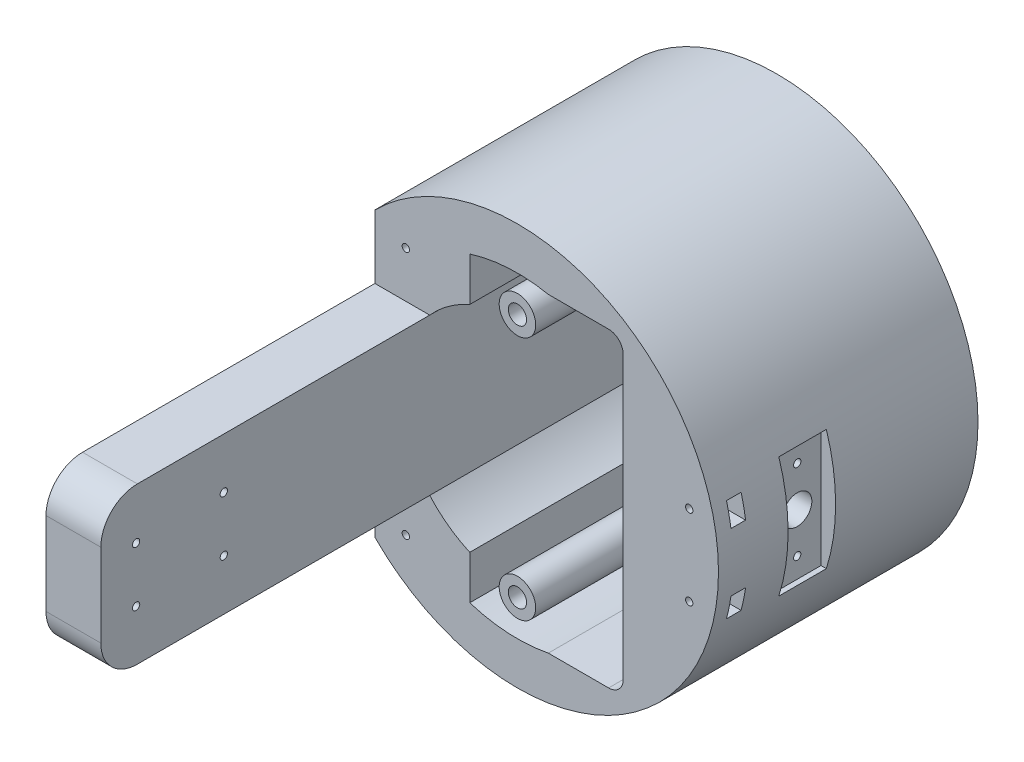
from build123d import *

# Parameters (mm, degrees)
SKETCH1_R            = 55
BOSS_EXTRUDE1_DEPTH  = 40
SKETCH2_W            = 20.494473429
SKETCH2_H            = 85
CUT_EXTRUDE1_DEPTH   = 88.464278423
BOSS_EXTRUDE2_DEPTH  = 40
SKETCH4_W            = 40
SKETCH4_H            = 85
CUT_EXTRUDE2_DEPTH   = 0.00527065
FILLET1_R            = 4
SKETCH5_R            = 4
CUT_EXTRUDE3_DEPTH   = 26.05598176
SKETCH6_W            = 13
SKETCH6_H            = 33
CUT_EXTRUDE4_DEPTH   = 4
SKETCH7_R            = 1
CUT_EXTRUDE5_DEPTH   = 22.05598176
SKETCH8_W            = 4
SKETCH8_H            = 6
CUT_EXTRUDE6_DEPTH   = 88.464278423
BOSS_EXTRUDE3_DEPTH  = 40
CUT_EXTRUDE7_DEPTH   = 88.464278423
SKETCH11_W           = 15
SKETCH11_H           = 42.720018726
BOSS_EXTRUDE4_DEPTH  = 93.97947282
SKETCH12_R           = 1
CUT_EXTRUDE8_DEPTH   = 165.974237798
SKETCH13_R           = 2.45
CUT_EXTRUDE9_DEPTH   = 4
CUT_EXTRUDE10_DEPTH  = 122.992382186
BOSS_EXTRUDE5_START  = 22
SKETCH15_W           = 4
SKETCH15_H           = 6
BOSS_EXTRUDE5_DEPTH  = 22
BOSS_EXTRUDE6_START  = 5
SKETCH16_W           = 4
SKETCH16_H           = 6
BOSS_EXTRUDE6_DEPTH  = 5
SKETCH17_R           = 5
BOSS_EXTRUDE7_DEPTH  = 62
BOSS_EXTRUDE8_DEPTH  = 4
SKETCH19_R           = 5
BOSS_EXTRUDE9_DEPTH  = 4
SKETCH20_R           = 2.5
CUT_EXTRUDE11_DEPTH  = 7
CUT_EXTRUDE12_START  = -1
SKETCH21_R           = 5
CUT_EXTRUDE12_DEPTH  = 1
SKETCH22_R           = 1
CUT_EXTRUDE13_DEPTH  = 10
CUT_EXTRUDE14_REACH  = 174.66
SKETCH23_W           = 4
SKETCH23_H           = 6
SKETCH24_W           = 4
SKETCH24_H           = 7
SKETCH24_H_2         = 6.292378966
CUT_EXTRUDE15_DEPTH  = 13
CUT_EXTRUDE16_REACH  = 180.786
SKETCH25_R           = 3.5
SKETCH27_R           = 7.5
SKETCH27_R_2         = 3.5
BOSS_EXTRUDE11_DEPTH = 9
FILLET3_R            = 10
FILLET4_R            = 8
FILLET5_R            = 4


with BuildPart() as part:
    # Sketch1 → Boss-Extrude1 (new body)
    with BuildSketch(Plane.XY):
        Circle(SKETCH1_R)
        with BuildLine():
            Line((1.5, -40), (-1.5, -40))
            ThreePointArc((-1.5, -40), (-8.571067812, -37.071067812), (-11.5, -30))
            ThreePointArc((-11.5, -30), (-32.128647653, 0), (-11.5, 30))
            ThreePointArc((-11.5, 30), (-8.571067812, 37.071067812), (-1.5, 40))
            Line((-1.5, 40), (1.5, 40))
            ThreePointArc((1.5, 40), (8.571067812, 37.071067812), (11.5, 30))
            ThreePointArc((11.5, 30), (32.128647653, 0), (11.5, -30))
            ThreePointArc((11.5, -30), (8.571067812, -37.071067812), (1.5, -40))
        make_face(mode=Mode.SUBTRACT)
    extrude(amount=BOSS_EXTRUDE1_DEPTH)

    # Sketch2 → Cut-Extrude1 (cut, through all)
    with BuildSketch(Plane(origin=(0, 0, 0), x_dir=(-1, 0, 0), z_dir=(0, 0, -1))):
        with Locations((-18.691510876, 0)):
            Rectangle(SKETCH2_W, SKETCH2_H)
    extrude(amount=-CUT_EXTRUDE1_DEPTH, mode=Mode.SUBTRACT)

    # Sketch3 → Boss-Extrude2 (add, through all)
    with BuildSketch(Plane(origin=(0, 0, 0), x_dir=(-1, 0, 0), z_dir=(0, 0, -1))):
        with BuildLine():
            Line((-28.93874759, 13.957037218), (-28.93874759, -13.957037218))
            ThreePointArc((-28.93874759, -13.957037218), (-32.128647653, 0), (-28.93874759, 13.957037218))
        make_face()
    extrude(amount=-BOSS_EXTRUDE2_DEPTH)

    # Sketch4 → Cut-Extrude2 (cut)
    with BuildSketch(Plane.ZY.offset(-28.93874759)):
        with Locations((20, 0)):
            Rectangle(SKETCH4_W, SKETCH4_H)
    extrude(amount=-CUT_EXTRUDE2_DEPTH, mode=Mode.SUBTRACT)

    # Fillet1
    fillet1_edges = [part.edges().sort_by_distance(p)[0] for p in [
        (28.94401824, 42.5, 20),
        (28.94401824, -42.5, 20),
    ]]
    fillet(fillet1_edges, radius=FILLET1_R)

    # Sketch5 → Cut-Extrude3 (cut)
    with BuildSketch(Plane(origin=(55, 0, 0), x_dir=(0, 0, -1), z_dir=(1, 0, 0))):
        with Locations(Location((-18.45620411, 0, 0), (0, 0, 180))):
            Circle(SKETCH5_R)
    extrude(amount=-CUT_EXTRUDE3_DEPTH, mode=Mode.SUBTRACT)

    # Sketch6 → Cut-Extrude4 (cut)
    with BuildSketch(Plane(origin=(55, 0, 0), x_dir=(0, 0, -1), z_dir=(1, 0, 0))):
        with Locations((-18.45620411, 0)):
            Rectangle(SKETCH6_W, SKETCH6_H)
    extrude(amount=-CUT_EXTRUDE4_DEPTH, mode=Mode.SUBTRACT)

    # Sketch7 → Cut-Extrude5 (cut)
    with BuildSketch(Plane(origin=(51, 0, 0), x_dir=(0, 0, -1), z_dir=(1, 0, 0))):
        with Locations((-18.45620411, 11)):
            Circle(SKETCH7_R)
        with Locations((-18.45620411, -11)):
            Circle(SKETCH7_R)
    extrude(amount=-CUT_EXTRUDE5_DEPTH, mode=Mode.SUBTRACT)

    # Sketch8 → Cut-Extrude6 (cut, through all)
    with BuildSketch(Plane(origin=(0, 0, 0), x_dir=(-1, 0, 0), z_dir=(0, 0, -1))):
        with Locations((-45, 11)):
            Rectangle(SKETCH8_W, SKETCH8_H)
        with Locations((-45, -11)):
            Rectangle(SKETCH8_W, SKETCH8_H)
    extrude(amount=-CUT_EXTRUDE6_DEPTH, mode=Mode.SUBTRACT)

    # Sketch9 → Boss-Extrude3 (add, through all)
    with BuildSketch(Plane.XY.offset(40)):
        with BuildLine():
            Line((-24, 21.360009363), (-24, -21.360009363))
            ThreePointArc((-24, -21.360009363), (-32.128647653, 0), (-24, 21.360009363))
        make_face()
    extrude(amount=-BOSS_EXTRUDE3_DEPTH)

    # Sketch10 → Cut-Extrude7 (cut, through all)
    with BuildSketch(Plane.XY.offset(40)):
        with BuildLine():
            Line((-39, 38.781438859), (-39, -38.781438859))
            ThreePointArc((-39, -38.781438859), (-55, 0), (-39, 38.781438859))
        make_face()
    extrude(amount=-CUT_EXTRUDE7_DEPTH, mode=Mode.SUBTRACT)

    # Sketch11 → Boss-Extrude4 (add)
    with BuildSketch(Plane.XY.offset(40)):
        with Locations((-31.5, 0)):
            Rectangle(SKETCH11_W, SKETCH11_H)
    extrude(amount=BOSS_EXTRUDE4_DEPTH)

    # Sketch12 → Cut-Extrude8 (cut, through all)
    with BuildSketch(Plane(origin=(-24, 0, 0), x_dir=(0, 0, -1), z_dir=(1, 0, 0))):
        with Locations((-124.32947282, -7.474399757)):
            Circle(SKETCH12_R)
        with Locations((-124.32947282, 7.525600243)):
            Circle(SKETCH12_R)
        with Locations((-100.32947282, -7.474399757)):
            Circle(SKETCH12_R)
        with Locations((-100.32947282, 7.525600243)):
            Circle(SKETCH12_R)
    extrude(amount=-CUT_EXTRUDE8_DEPTH, mode=Mode.SUBTRACT)

    # Sketch13 → Cut-Extrude9 (cut)
    with BuildSketch(Plane.ZY.offset(39)):
        with Locations((100.32947282, 7.525600243)):
            Circle(SKETCH13_R)
        with Locations((124.32947282, 7.525600243)):
            Circle(SKETCH13_R)
        with Locations((124.32947282, -7.474399757)):
            Circle(SKETCH13_R)
        with Locations((100.32947282, -7.474399757)):
            Circle(SKETCH13_R)
    extrude(amount=-CUT_EXTRUDE9_DEPTH, mode=Mode.SUBTRACT)

    # Sketch14 → Cut-Extrude10 (cut, through all)
    with BuildSketch(Plane.XY.offset(40)):
        with BuildLine():
            Line((-24, -21.360009363), (-24, 21.360009363))
            ThreePointArc((-24, 21.360009363), (-18.950756064, 25.944534003), (-13.047599403, 29.360009363))
            Line((-13.047599403, 29.360009363), (-13.047599403, 41.319679523))
            ThreePointArc((-13.047599403, 41.319679523), (9.151901203, 42.353258086), (28.94401824, 32.245923374))
            Line((28.94401824, 32.245923374), (28.94401824, -32.245923374))
            ThreePointArc((28.94401824, -32.245923374), (9.151901203, -42.353258086), (-13.047599403, -41.319679523))
            Line((-13.047599403, -41.319679523), (-13.047599403, -29.360009363))
            ThreePointArc((-13.047599403, -29.360009363), (-18.950756064, -25.944534003), (-24, -21.360009363))
        make_face()
    extrude(amount=-CUT_EXTRUDE10_DEPTH, mode=Mode.SUBTRACT)

    # Sketch15 → Boss-Extrude5 (add)
    with BuildSketch(Plane(origin=(0, 0, 0), x_dir=(-1, 0, 0), z_dir=(0, 0, -1)).offset(BOSS_EXTRUDE5_START)):
        with BuildLine():
            Line((39, 38.781438859), (39, -38.781438859))
            ThreePointArc((39, -38.781438859), (-55, 0), (39, 38.781438859))
        make_face()
        with BuildLine():
            Line((-24.94401824, -42.5), (-8.444274161, -42.5))
            ThreePointArc((-8.444274161, -42.5), (2.376118669, -43.265573221), (13.047599403, -41.319679523))
            Line((13.047599403, -41.319679523), (13.047599403, -29.360009363))
            ThreePointArc((13.047599403, -29.360009363), (18.950756064, -25.944534003), (24, -21.360009363))
            Line((24, -21.360009363), (24, 21.360009363))
            ThreePointArc((24, 21.360009363), (18.950756064, 25.944534003), (13.047599403, 29.360009363))
            Line((13.047599403, 29.360009363), (13.047599403, 41.319679523))
            ThreePointArc((13.047599403, 41.319679523), (2.376118669, 43.265573221), (-8.444274161, 42.5))
            Line((-8.444274161, 42.5), (-24.94401824, 42.5))
            ThreePointArc((-24.94401824, 42.5), (-27.772445365, 41.328427125), (-28.94401824, 38.5))
            Line((-28.94401824, 38.5), (-28.94401824, -38.5))
            ThreePointArc((-28.94401824, -38.5), (-27.772445365, -41.328427125), (-24.94401824, -42.5))
        make_face(mode=Mode.SUBTRACT)
        with Locations((-45, -11)):
            Rectangle(SKETCH15_W, SKETCH15_H, mode=Mode.SUBTRACT)
        with Locations((-45, 11)):
            Rectangle(SKETCH15_W, SKETCH15_H, mode=Mode.SUBTRACT)
    extrude(amount=-BOSS_EXTRUDE5_DEPTH)

    # Sketch16 → Boss-Extrude6 (add)
    with BuildSketch(Plane(origin=(0, 0, -22), x_dir=(-1, 0, 0), z_dir=(0, 0, -1)).offset(BOSS_EXTRUDE6_START)):
        with BuildLine():
            Line((39, -38.781438859), (39, 38.781438859))
            ThreePointArc((39, 38.781438859), (-55, 0), (39, -38.781438859))
        make_face()
        with Locations((-45, -11)):
            Rectangle(SKETCH16_W, SKETCH16_H, mode=Mode.SUBTRACT)
        with Locations((-45, 11)):
            Rectangle(SKETCH16_W, SKETCH16_H, mode=Mode.SUBTRACT)
    extrude(amount=-BOSS_EXTRUDE6_DEPTH)

    # Sketch17 → Boss-Extrude7 (add)
    with BuildSketch(Plane.XY.offset(-22)):
        with Locations(Location((0, 33.5, 0), (0, 0, 180))):
            Circle(SKETCH17_R)
        with Locations(Location((0, -33.5, 0), (0, 0, 180))):
            Circle(SKETCH17_R)
    extrude(amount=BOSS_EXTRUDE7_DEPTH)

    # Sketch18 → Boss-Extrude8 (add)
    with BuildSketch(Plane.XY.offset(40)):
        with BuildLine():
            Line((-24, -21.360009363), (-39, -21.360009363))
            Line((-39, -21.360009363), (-39, -38.781438859))
            ThreePointArc((-39, -38.781438859), (55, 0), (-39, 38.781438859))
            Line((-39, 38.781438859), (-39, 21.360009363))
            Line((-39, 21.360009363), (-24, 21.360009363))
            ThreePointArc((-24, 21.360009363), (-18.950756064, 25.944534003), (-13.047599403, 29.360009363))
            Line((-13.047599403, 29.360009363), (-13.047599403, 41.319679523))
            ThreePointArc((-13.047599403, 41.319679523), (-2.376118669, 43.265573221), (8.444274161, 42.5))
            Line((8.444274161, 42.5), (24.94401824, 42.5))
            ThreePointArc((24.94401824, 42.5), (27.772445365, 41.328427125), (28.94401824, 38.5))
            Line((28.94401824, 38.5), (28.94401824, -38.5))
            ThreePointArc((28.94401824, -38.5), (27.772445365, -41.328427125), (24.94401824, -42.5))
            Line((24.94401824, -42.5), (8.444274161, -42.5))
            ThreePointArc((8.444274161, -42.5), (-2.376118669, -43.265573221), (-13.047599403, -41.319679523))
            Line((-13.047599403, -41.319679523), (-13.047599403, -29.360009363))
            ThreePointArc((-13.047599403, -29.360009363), (-18.950756064, -25.944534003), (-24, -21.360009363))
        make_face()
    extrude(amount=BOSS_EXTRUDE8_DEPTH)

    # Sketch19 → Boss-Extrude9 (add)
    with BuildSketch(Plane.XY.offset(40)):
        with Locations(Location((0, 33.5, 0), (0, 0, 180))):
            Circle(SKETCH19_R)
        with Locations(Location((0, -33.5, 0), (0, 0, 180))):
            Circle(SKETCH19_R)
    extrude(amount=BOSS_EXTRUDE9_DEPTH)

    # Sketch20 → Cut-Extrude11 (cut)
    with BuildSketch(Plane.XY.offset(44)):
        with Locations((0, 33.5)):
            Circle(SKETCH20_R)
        with Locations((0, -33.5)):
            Circle(SKETCH20_R)
    extrude(amount=-CUT_EXTRUDE11_DEPTH, mode=Mode.SUBTRACT)

    # Sketch21 → Cut-Extrude12 (cut)
    with BuildSketch(Plane.XY.offset(-22).offset(CUT_EXTRUDE12_START)):
        with BuildLine():
            Line((8.444274161, -42.5), (24.94401824, -42.5))
            ThreePointArc((24.94401824, -42.5), (27.772445365, -41.328427125), (28.94401824, -38.5))
            Line((28.94401824, -38.5), (28.94401824, 38.5))
            ThreePointArc((28.94401824, 38.5), (27.772445365, 41.328427125), (24.94401824, 42.5))
            Line((24.94401824, 42.5), (8.444274161, 42.5))
            ThreePointArc((8.444274161, 42.5), (-2.376118669, 43.265573221), (-13.047599403, 41.319679523))
            Line((-13.047599403, 41.319679523), (-13.047599403, 29.360009363))
            ThreePointArc((-13.047599403, 29.360009363), (-18.950756064, 25.944534003), (-24, 21.360009363))
            Line((-24, 21.360009363), (-24, -21.360009363))
            ThreePointArc((-24, -21.360009363), (-18.950756064, -25.944534003), (-13.047599403, -29.360009363))
            Line((-13.047599403, -29.360009363), (-13.047599403, -41.319679523))
            ThreePointArc((-13.047599403, -41.319679523), (-2.376118669, -43.265573221), (8.444274161, -42.5))
        make_face()
        with Locations((0, 33.5)):
            Circle(SKETCH21_R, mode=Mode.SUBTRACT)
        with Locations((0, -33.5)):
            Circle(SKETCH21_R, mode=Mode.SUBTRACT)
    extrude(amount=CUT_EXTRUDE12_DEPTH, mode=Mode.SUBTRACT)

    # Sketch22 → Cut-Extrude13 (cut)
    with BuildSketch(Plane.XY.offset(44)):
        with Locations((-30.537878891, -34)):
            Circle(SKETCH22_R)
        with Locations((-30.537878891, 34)):
            Circle(SKETCH22_R)
        with Locations((47, 11)):
            Circle(SKETCH22_R)
        with Locations((47, -11)):
            Circle(SKETCH22_R)
    extrude(amount=-CUT_EXTRUDE13_DEPTH, mode=Mode.SUBTRACT)

    # Sketch23 → Cut-Extrude14 (cut, up to next)
    with BuildSketch(Plane(origin=(55, 0, 0), x_dir=(0, 0, -1), z_dir=(1, 0, 0)), mode=Mode.PRIVATE) as cut_extrude14_sk1:
        with Locations((-38, -11)):
            Rectangle(SKETCH23_W, SKETCH23_H)
    cut_extrude14_tool1 = extrude(cut_extrude14_sk1.sketch, amount=-CUT_EXTRUDE14_REACH, mode=Mode.PRIVATE) & part.part
    # Sketch23 → Cut-Extrude14 (cut, up to next)
    with BuildSketch(Plane(origin=(55, 0, 0), x_dir=(0, 0, -1), z_dir=(1, 0, 0)), mode=Mode.PRIVATE) as cut_extrude14_sk2:
        with Locations((-38, 11)):
            Rectangle(SKETCH23_W, SKETCH23_H)
    cut_extrude14_tool2 = extrude(cut_extrude14_sk2.sketch, amount=-CUT_EXTRUDE14_REACH, mode=Mode.PRIVATE) & part.part
    add(cut_extrude14_tool1.solids().sort_by_distance((55, -11, 38))[0], mode=Mode.SUBTRACT)
    add(cut_extrude14_tool2.solids().sort_by_distance((55, 11, 38))[0], mode=Mode.SUBTRACT)

    # Sketch24 → Cut-Extrude15 (cut)
    with BuildSketch(Plane.ZY.offset(39)):
        with Locations((38.5, 34)):
            Rectangle(SKETCH24_W, SKETCH24_H)
        with Locations((38.5, -34)):
            Rectangle(SKETCH24_W, SKETCH24_H_2)
    extrude(amount=-CUT_EXTRUDE15_DEPTH, mode=Mode.SUBTRACT)

    # Sketch25 → Cut-Extrude16 (cut, up to next)
    with BuildSketch(Plane(origin=(0, 0, -27), x_dir=(-1, 0, 0), z_dir=(0, 0, -1)), mode=Mode.PRIVATE) as cut_extrude16_sk1:
        with Locations(Location((0, 0, 0), (0, 0, 90))):
            Circle(SKETCH25_R)
    cut_extrude16_tool1 = extrude(cut_extrude16_sk1.sketch, amount=-CUT_EXTRUDE16_REACH, mode=Mode.PRIVATE) & part.part
    add(cut_extrude16_tool1.solids().sort_by_distance((0, 0, -27))[0], mode=Mode.SUBTRACT)

    # Sketch27 → Boss-Extrude11 (add)
    with BuildSketch(Plane.XY.offset(-23)):
        Circle(SKETCH27_R)
        with Locations(Location((0, 0, 0), (0, 0, 90))):
            Circle(SKETCH27_R_2, mode=Mode.SUBTRACT)
    extrude(amount=BOSS_EXTRUDE11_DEPTH)

    # Fillet3
    fillet3_edges = [part.edges().sort_by_distance(p)[0] for p in [
        (-31.5, -21.360009363, 133.97947282),
        (-31.5, 21.360009363, 133.97947282),
    ]]
    fillet(fillet3_edges, radius=FILLET3_R)

    # Fillet4
    # the kernel refuses this fillet: 8 mm, written as the material it adds along each edge
    with BuildSketch(Plane(origin=(0, -33.5, -23), x_dir=(1, 0, 0), z_dir=(0, -1, 0))) as fillet4_piece_1:
        with BuildLine():
            CenterArc((5 + FILLET4_R, FILLET4_R), FILLET4_R, 180, 90)
            Line((5, FILLET4_R), (5, 0))
            Line((5, 0), (5 + FILLET4_R, 0))
        make_face()
    revolve(axis=Axis((0, -33.5, -23), (0, 0, 1)))
    with BuildSketch(Plane(origin=(0, 33.5, -23), x_dir=(1, 0, 0), z_dir=(0, -1, 0))) as fillet4_piece_2:
        with BuildLine():
            CenterArc((5 + FILLET4_R, FILLET4_R), FILLET4_R, 180, 90)
            Line((5, FILLET4_R), (5, 0))
            Line((5, 0), (5 + FILLET4_R, 0))
        make_face()
    revolve(axis=Axis((0, 33.5, -23), (0, 0, 1)))

    # Fillet5
    fillet5_edges = [part.edges().sort_by_distance(p)[0] for p in [
        (-7.5, 0, -23),
    ]]
    fillet(fillet5_edges, radius=FILLET5_R)


solid = part.part
